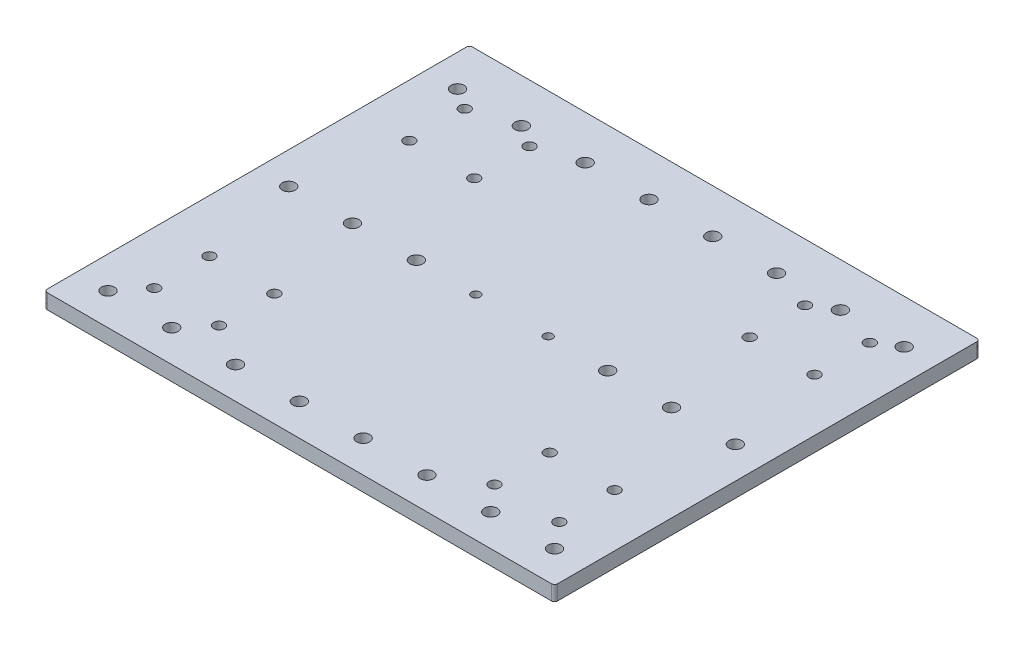
from build123d import *

# Parameters (mm, degrees)
SKETCH1_W           = 240
SKETCH1_H           = 200
BOSS_EXTRUDE1_DEPTH = 3.5
SKETCH2_R           = 2.55
CUT_EXTRUDE1_DEPTH  = 157.361760031
SKETCH3_R           = 2.05
CUT_EXTRUDE2_DEPTH  = 157.361760031
SKETCH4_R           = 3.05
CUT_EXTRUDE3_DEPTH  = 157.361760031
FILLET1_R           = 1.5


with BuildPart() as part:
    # Sketch1 → Boss-Extrude1 (new, symmetric)
    with BuildSketch(Plane(origin=(0, 0, 0), x_dir=(1, 0, 0), z_dir=(0, 1, 0))):
        Rectangle(SKETCH1_W, SKETCH1_H)
    extrude(amount=BOSS_EXTRUDE1_DEPTH, both=True)

    # Sketch2 → Cut-Extrude1 (cut, through all)
    with BuildSketch(Plane(origin=(0, 3.5, 0), x_dir=(1, 0, 0), z_dir=(0, 1, 0))):
        with Locations((-95.25, 73)):
            Circle(SKETCH2_R)
        with Locations((-95.25, 47)):
            Circle(SKETCH2_R)
        with Locations((-64.75, 73)):
            Circle(SKETCH2_R)
        with Locations((-64.75, 47)):
            Circle(SKETCH2_R)
        with Locations((-95.25, -47)):
            Circle(SKETCH2_R)
        with Locations((-95.25, -73)):
            Circle(SKETCH2_R)
        with Locations((-64.75, -73)):
            Circle(SKETCH2_R)
        with Locations((-64.75, -47)):
            Circle(SKETCH2_R)
        with Locations((95.25, -47)):
            Circle(SKETCH2_R)
        with Locations((64.75, -47)):
            Circle(SKETCH2_R)
        with Locations((64.75, -73)):
            Circle(SKETCH2_R)
        with Locations((95.25, -73)):
            Circle(SKETCH2_R)
        with Locations((64.75, 73)):
            Circle(SKETCH2_R)
        with Locations((64.75, 47)):
            Circle(SKETCH2_R)
        with Locations((95.25, 73)):
            Circle(SKETCH2_R)
        with Locations((95.25, 47)):
            Circle(SKETCH2_R)
    extrude(amount=-CUT_EXTRUDE1_DEPTH, mode=Mode.SUBTRACT)

    # Sketch3 → Cut-Extrude2 (cut, through all)
    with BuildSketch(Plane(origin=(0, 3.5, 0), x_dir=(1, 0, 0), z_dir=(0, 1, 0))):
        with Locations((-17, 0)):
            Circle(SKETCH3_R)
        with Locations((17, 0)):
            Circle(SKETCH3_R)
    extrude(amount=-CUT_EXTRUDE2_DEPTH, mode=Mode.SUBTRACT)

    # Sketch4 → Cut-Extrude3 (cut, through all)
    with BuildSketch(Plane(origin=(0, 3.5, 0), x_dir=(1, 0, 0), z_dir=(0, 1, 0))):
        with Locations((-105, 79.393522691)):
            Circle(SKETCH4_R)
        with Locations((-75, 79.393522691)):
            Circle(SKETCH4_R)
        with Locations((-45, 79.393522691)):
            Circle(SKETCH4_R)
        with Locations((-15, 79.393522691)):
            Circle(SKETCH4_R)
        with Locations((15, 79.393522691)):
            Circle(SKETCH4_R)
        with Locations((45, 79.393522691)):
            Circle(SKETCH4_R)
        with Locations((75, 79.393522691)):
            Circle(SKETCH4_R)
        with Locations((105, 79.393522691)):
            Circle(SKETCH4_R)
        with Locations((-105, 0)):
            Circle(SKETCH4_R)
        with Locations((-105, -85)):
            Circle(SKETCH4_R)
        with Locations((-75, 0)):
            Circle(SKETCH4_R)
        with Locations((-45, 0)):
            Circle(SKETCH4_R)
        with Locations((45, 0)):
            Circle(SKETCH4_R)
        with Locations((75, 0)):
            Circle(SKETCH4_R)
        with Locations((105, 0)):
            Circle(SKETCH4_R)
        with Locations((-75, -85)):
            Circle(SKETCH4_R)
        with Locations((-45, -85)):
            Circle(SKETCH4_R)
        with Locations((-15, -85)):
            Circle(SKETCH4_R)
        with Locations((15, -85)):
            Circle(SKETCH4_R)
        with Locations((45, -85)):
            Circle(SKETCH4_R)
        with Locations((75, -85)):
            Circle(SKETCH4_R)
        with Locations((105, -85)):
            Circle(SKETCH4_R)
    extrude(amount=-CUT_EXTRUDE3_DEPTH, mode=Mode.SUBTRACT)

    # Fillet1
    fillet1_edges = [part.edges().sort_by_distance(p)[0] for p in [
        (-120, 0, -100),
        (120, 0, -100),
        (-120, 0, 100),
        (120, 0, 100),
    ]]
    fillet(fillet1_edges, radius=FILLET1_R)


solid = part.part
